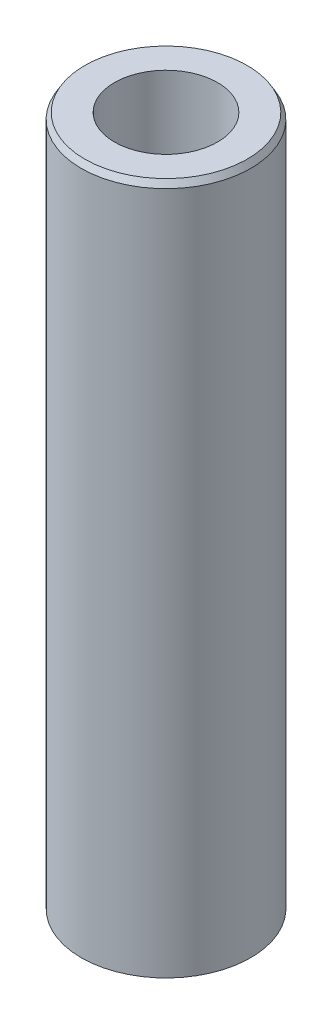
from build123d import *
from OCP.BRepFilletAPI import BRepFilletAPI_MakeChamfer

# Parameters (mm, degrees)
SKETCH1_R           = 35
BOSS_EXTRUDE1_DEPTH = 286.220203176
SKETCH2_R           = 21.283153091
CUT_EXTRUDE1_DEPTH  = 291.468595043
CHAMFER1_SIZE       = 2.561380831
CHAMFER1_SIZE2      = 1.478813913


with BuildPart() as part:
    # Sketch1 → Boss-Extrude1 (new body)
    with BuildSketch(Plane(origin=(0, 0, 0), x_dir=(1, 0, 0), z_dir=(0, 1, 0))):
        Circle(SKETCH1_R)
    extrude(amount=BOSS_EXTRUDE1_DEPTH)

    # Sketch2 → Cut-Extrude1 (cut, through all)
    with BuildSketch(Plane(origin=(0, 0, 0), x_dir=(1, 0, 0), z_dir=(0, 1, 0))):
        Circle(SKETCH2_R)
    extrude(amount=CUT_EXTRUDE1_DEPTH, mode=Mode.SUBTRACT)

    # Chamfer1: one chamfer whose edges measure the first distance from different faces: ONE call of the kernel's chamfer builder (chamfer() names one face for all edges)
    chamfer1_edges_1 = [part.edges().sort_by_distance(p)[0] for p in [
        (-35, 286.220203176, 0),
    ]]
    chamfer1_side_1 = [part.faces().sort_by_distance(p)[0] for p in [
        (-35, 143.110101588, 0),
    ]]
    chamfer1_edges_2 = [part.edges().sort_by_distance(p)[0] for p in [
        (-35, 0, 0),
    ]]
    chamfer1_side_2 = [part.faces().sort_by_distance(p)[0] for p in [
        (-34.010050506, 0, 0),
    ]]
    chamfer1 = BRepFilletAPI_MakeChamfer(part.part.solid().wrapped)
    for e in chamfer1_edges_1:
        chamfer1.Add(CHAMFER1_SIZE, CHAMFER1_SIZE2, e.wrapped, chamfer1_side_1[0].wrapped)  # the first distance lies on this face
    for e in chamfer1_edges_2:
        chamfer1.Add(CHAMFER1_SIZE, CHAMFER1_SIZE2, e.wrapped, chamfer1_side_2[0].wrapped)  # the first distance lies on this face
    add(Compound.cast(chamfer1.Shape()), mode=Mode.REPLACE)


solid = part.part
